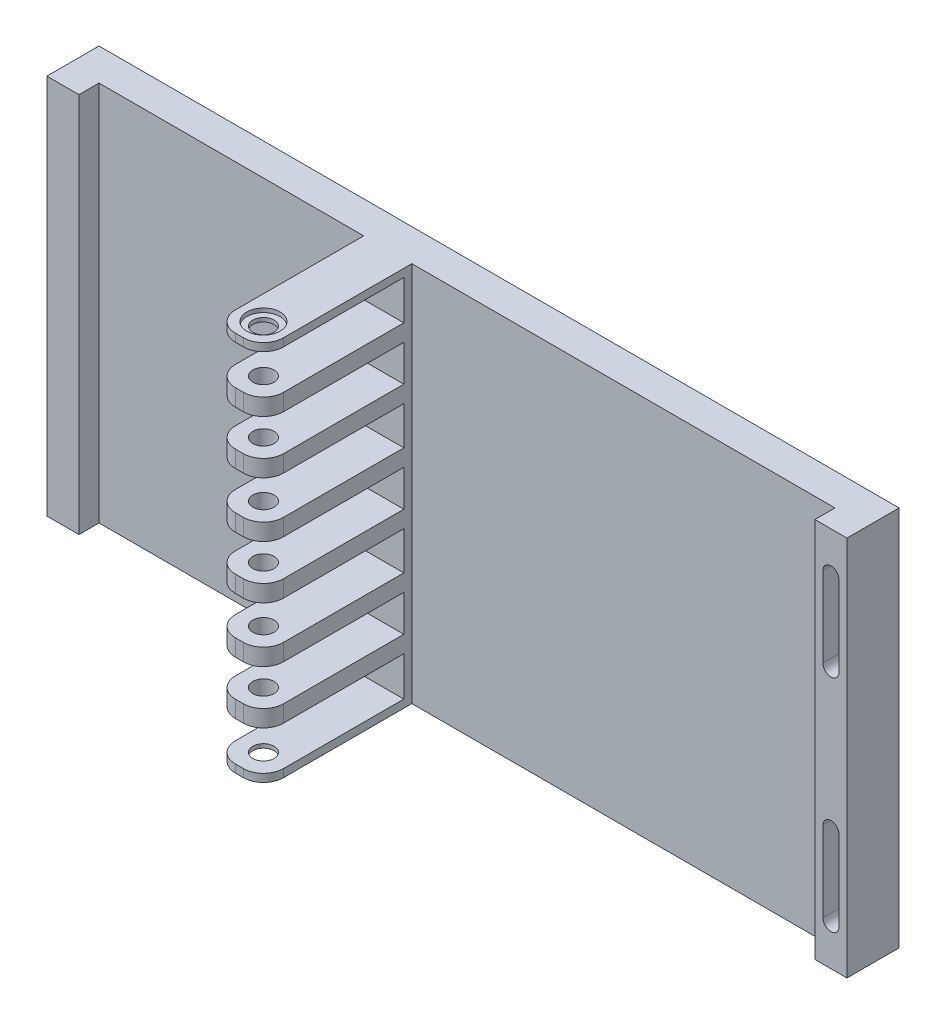
from build123d import *

# Parameters (mm, degrees)
SKETCH1_W            = 95
SKETCH1_H            = 12
BOSS_EXTRUDE1_DEPTH  = 10
SKETCH3_W            = 12
SKETCH3_H            = 1.975
SKETCH3_H_2          = 4.2
BOSS_EXTRUDE2_DEPTH  = 35
FILLET1_R            = 5
FILLET1_OF_MIRROR1_R = 5
SKETCH5_R            = 2.65
CUT_EXTRUDE1_DEPTH   = 106.80170131
SKETCH7_R            = 4.15
SKETCH7_R_2          = 2.65
CUT_EXTRUDE2_DEPTH   = 1
SKETCH8_W            = 74
SKETCH8_H            = 95
SKETCH8_W_2          = 113.5
BOSS_EXTRUDE3_DEPTH  = 8
SKETCH9_W            = 8
SKETCH9_H            = 95
BOSS_EXTRUDE4_DEPTH  = 5
CUT_EXTRUDE3_DEPTH   = 10
LPATTERN1_COUNT      = 2
LPATTERN1_PITCH      = 55


with BuildPart() as part:
    # Sketch1 → Boss-Extrude1 (new body)
    with BuildSketch(Plane(origin=(0, 0, 0), x_dir=(0, 1, 0), z_dir=(0, 0, 1))):
        with Locations((-47.5, 6)):
            Rectangle(SKETCH1_W, SKETCH1_H)
    extrude(amount=BOSS_EXTRUDE1_DEPTH)

    # Sketch3 → Boss-Extrude2 (add)
    with BuildSketch(Plane.XY.offset(10)):
        with Locations((-6, -0.9875)):
            Rectangle(SKETCH3_W, SKETCH3_H)
        with Locations((-6, -13.875)):
            Rectangle(SKETCH3_W, SKETCH3_H_2)
        with Locations((-6, -27.125)):
            Rectangle(SKETCH3_W, SKETCH3_H_2)
        with Locations((-6, -40.875)):
            Rectangle(SKETCH3_W, SKETCH3_H_2)
    boss_extrude2 = extrude(amount=BOSS_EXTRUDE2_DEPTH)

    # Fillet1
    fillet1_edges = [part.edges().sort_by_distance(p)[0] for p in [
        (-12, -0.9875, 45),
        (0, -0.9875, 45),
        (-12, -13.875, 45),
        (0, -13.875, 45),
        (-12, -40.875, 45),
        (-12, -27.125, 45),
        (0, -27.125, 45),
        (0, -40.875, 45),
    ]]
    fillet(fillet1_edges, radius=FILLET1_R)

    # Mirror1: Boss-Extrude2 across plane
    add(boss_extrude2.mirror(Plane.ZX.offset(-47.5)))

    # Fillet1 of Mirror1
    fillet1_of_mirror1_edges = [part.edges().sort_by_distance(p)[0] for p in [
        (-12, -94.0125, 45),
        (0, -94.0125, 45),
        (-12, -81.125, 45),
        (0, -81.125, 45),
        (-12, -54.125, 45),
        (-12, -67.875, 45),
        (0, -67.875, 45),
        (0, -54.125, 45),
    ]]
    fillet(fillet1_of_mirror1_edges, radius=FILLET1_OF_MIRROR1_R)

    # Sketch5 → Cut-Extrude1 (cut, through all)
    with BuildSketch(Plane(origin=(0, 0, 0), x_dir=(-1, 0, 0), z_dir=(0, 1, 0))):
        with Locations((6, 39)):
            Circle(SKETCH5_R)
    extrude(amount=-CUT_EXTRUDE1_DEPTH, mode=Mode.SUBTRACT)

    # Sketch7 → Cut-Extrude2 (cut)
    with BuildSketch(Plane(origin=(0, 0, 0), x_dir=(-1, 0, 0), z_dir=(0, 1, 0))):
        with Locations((6, 39)):
            Circle(SKETCH7_R)
        with Locations((6, 39)):
            Circle(SKETCH7_R_2, mode=Mode.SUBTRACT)
    cut_extrude2 = extrude(amount=-CUT_EXTRUDE2_DEPTH, mode=Mode.SUBTRACT)

    # Mirror2: Cut-Extrude2 across plane
    add(cut_extrude2.mirror(Plane.ZX.offset(-47.5)), mode=Mode.SUBTRACT)

    # Sketch8 → Boss-Extrude3 (add)
    with BuildSketch(Plane(origin=(0, 0, 0), x_dir=(1, 0, 0), z_dir=(0, 0, -1))):
        with Locations((-49, 47.5)):
            Rectangle(SKETCH8_W, SKETCH8_H)
        with Locations((56.75, 47.5)):
            Rectangle(SKETCH8_W_2, SKETCH8_H)
    extrude(amount=-BOSS_EXTRUDE3_DEPTH)

    # Sketch9 → Boss-Extrude4 (add)
    with BuildSketch(Plane.XY.offset(8)):
        with Locations((109.5, -47.5)):
            Rectangle(SKETCH9_W, SKETCH9_H)
        with Locations((-82, -47.5)):
            Rectangle(SKETCH9_W, SKETCH9_H)
    extrude(amount=BOSS_EXTRUDE4_DEPTH)

    # Sketch11 → Cut-Extrude3 (cut)
    with BuildSketch(Plane.XY.offset(13)):
        with BuildLine():
            Line((111.5, -10), (111.5, -30))
            ThreePointArc((111.5, -30), (109.5, -32), (107.5, -30))
            Line((107.5, -30), (107.5, -10))
            ThreePointArc((107.5, -10), (109.5, -8), (111.5, -10))
        make_face()
    cut_extrude3 = extrude(amount=-CUT_EXTRUDE3_DEPTH, mode=Mode.SUBTRACT)

    # LPattern1: Cut-Extrude3 ×2
    with Locations(*[(0, -i * LPATTERN1_PITCH, 0) for i in range(1, LPATTERN1_COUNT)]):
        add(cut_extrude3, mode=Mode.SUBTRACT)


solid = part.part
